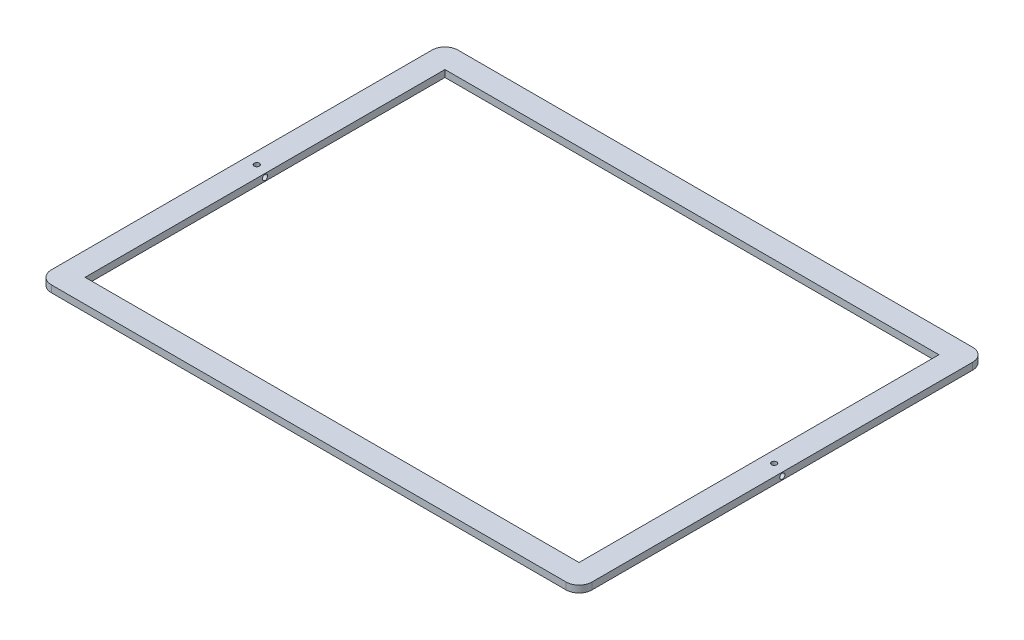
from build123d import *

# Parameters (mm, degrees)
SKETCH_1_W               = 625
SKETCH_1_H               = 470
SKETCH_1_W_2             = 571
SKETCH_1_H_2             = 416
EXTRUDE_1_DEPTH          = 4
FILLET_1_R               = 15
CUT_EXTRUDE_2_DEPTH      = 392.020779499
CUT_EXTRUDE_2_DEPTH_BACK = 392.020779499
SKETCH_3_R               = 3
SKETCH_4_R               = 3
CUT_EXTRUDE_3_DEPTH      = 392.082152495


with BuildPart() as part:
    # Эскиз1 → Бобышка-Вытянуть1 (new, symmetric)
    with BuildSketch(Plane(origin=(0, 0, 0), x_dir=(1, 0, 0), z_dir=(0, 1, 0))):
        Rectangle(SKETCH_1_W, SKETCH_1_H)
        Rectangle(SKETCH_1_W_2, SKETCH_1_H_2, mode=Mode.SUBTRACT)
    extrude(amount=EXTRUDE_1_DEPTH, both=True)

    # Скругление1
    fillet_1_edges = [part.edges().sort_by_distance(p)[0] for p in [
        (312.5, 0, 235),
        (-312.5, 0, 235),
        (312.5, 0, -235),
        (-312.5, 0, -235),
    ]]
    fillet(fillet_1_edges, radius=FILLET_1_R)

    # Эскиз3 → Вырез-Вытянуть2 (cut, two sides: drawn at the far end of the back side and taken through both)
    with BuildSketch(Plane(origin=(0, 0, 0), x_dir=(0, 0, -1), z_dir=(1, 0, 0)).offset(-CUT_EXTRUDE_2_DEPTH_BACK)):
        Circle(SKETCH_3_R)
    extrude(amount=CUT_EXTRUDE_2_DEPTH + CUT_EXTRUDE_2_DEPTH_BACK, mode=Mode.SUBTRACT)

    # Эскиз4 → Вырез-Вытянуть3 (cut, through all)
    with BuildSketch(Plane(origin=(0, 4, 0), x_dir=(1, 0, 0), z_dir=(0, 1, 0))):
        with Locations((-299, 4)):
            Circle(SKETCH_4_R)
        with Locations((299, 4)):
            Circle(SKETCH_4_R)
    extrude(amount=-CUT_EXTRUDE_3_DEPTH, mode=Mode.SUBTRACT)


solid = part.part
